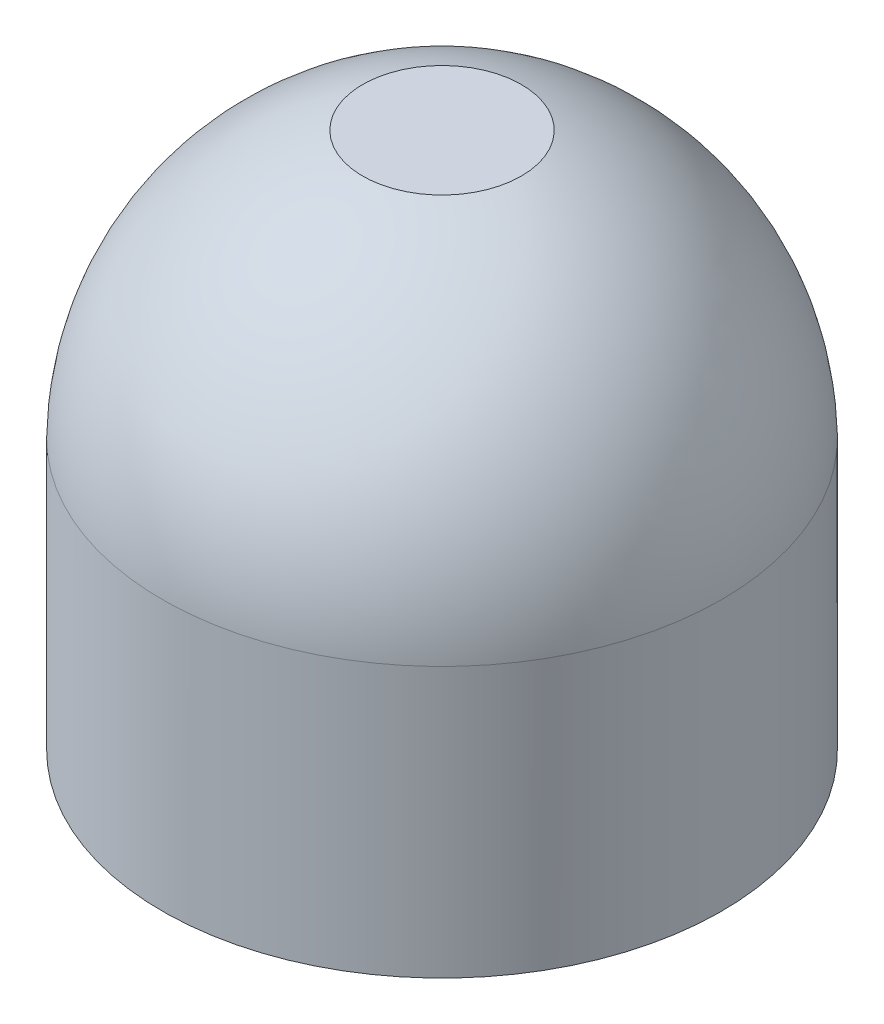
from build123d import *

# Parameters (mm, degrees)
SKETCH1_R           = 5.18
SKETCH1_R_2         = 4.38
BOSS_EXTRUDE1_DEPTH = 5
CUT_EXTRUDE1_DEPTH  = 5
CUT_EXTRUDE2_DEPTH  = 2
SKETCH6_R           = 2
CUT_EXTRUDE4_DEPTH  = 0.35


with BuildPart() as part:
    # Sketch1 → Boss-Extrude1 (new body)
    with BuildSketch(Plane(origin=(0, 0, 0), x_dir=(1, 0, 0), z_dir=(0, 1, 0))):
        Circle(SKETCH1_R)
        Circle(SKETCH1_R_2, mode=Mode.SUBTRACT)
    extrude(amount=BOSS_EXTRUDE1_DEPTH)

    # Sketch2 → Cut-Extrude1 (cut)
    with BuildSketch(Plane(origin=(0, 0, 0), x_dir=(1, 0, 0), z_dir=(0, 1, 0))):
        Polygon((1.327689147, 3.795637322), (1.327689147, 5.701107087), (-1.5, 5.701107087), (-1.5, 3.701107087), align=None)
    extrude(amount=CUT_EXTRUDE1_DEPTH, mode=Mode.SUBTRACT)

    # Sketch4 → Revolve1 (revolve)
    with BuildSketch(Plane.XY):
        with BuildLine():
            Line((5.18, 5), (0, 5))
            Line((0, 5), (0, 10.18))
            ThreePointArc((0, 10.18), (3.631715475, 8.631715475), (5.18, 5))
        make_face()
    revolve(axis=Axis((0, 5, 0), (0, 1, 0)))

    # Sketch5 → Cut-Extrude2 (cut)
    with BuildSketch(Plane(origin=(0, 5, 0), x_dir=(-1, 0, 0), z_dir=(0, -1, 0))):
        with BuildLine():
            Line((1.5, 3.436931771), (1.5, 6))
            Line((1.5, 6), (-1.327689147, 6))
            Line((-1.327689147, 6), (-1.327689147, 3.507098734))
            ThreePointArc((-1.327689147, 3.507098734), (-0.093024772, -3.748846008), (1.5, 3.436931771))
        make_face()
    extrude(amount=-CUT_EXTRUDE2_DEPTH, mode=Mode.SUBTRACT)

    # Sketch6 → Cut-Extrude4 (cut)
    with BuildSketch(Plane(origin=(0, 10.29, 0), x_dir=(-1, 0, 0), z_dir=(0, -1, 0))):
        Circle(SKETCH6_R)
    extrude(amount=CUT_EXTRUDE4_DEPTH, mode=Mode.SUBTRACT)


solid = part.part
